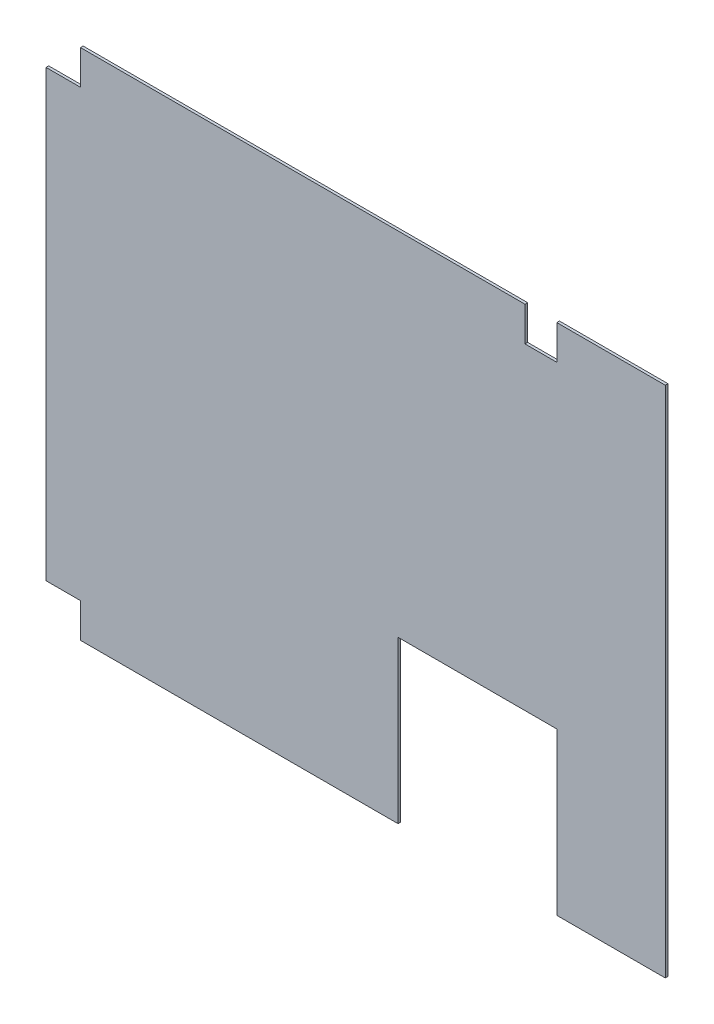
from build123d import *

# Parameters (mm, degrees)
SKETCH1_W           = 742.95
SKETCH1_H           = 615.95
BOSS_EXTRUDE1_DEPTH = 3.175
SKETCH2_W           = 41.275
SKETCH2_H           = 41.275
SKETCH2_W_2         = 38.1
SKETCH2_W_3         = 190.5
SKETCH2_H_2         = 193.675
CUT_EXTRUDE1_DEPTH  = 483.54777678


with BuildPart() as part:
    # Sketch1 → Boss-Extrude1 (new body)
    with BuildSketch(Plane.XY):
        Rectangle(SKETCH1_W, SKETCH1_H)
    extrude(amount=BOSS_EXTRUDE1_DEPTH)

    # Sketch2 → Cut-Extrude1 (cut, through all)
    with BuildSketch(Plane.XY.offset(3.175)):
        with Locations((-350.8375, 287.3375)):
            Rectangle(SKETCH2_W, SKETCH2_H)
        with Locations((-350.8375, -287.3375)):
            Rectangle(SKETCH2_W, SKETCH2_H)
        with Locations((222.25, 287.3375)):
            Rectangle(SKETCH2_W_2, SKETCH2_H)
        with Locations((146.05, -211.1375)):
            Rectangle(SKETCH2_W_3, SKETCH2_H_2)
    extrude(amount=-CUT_EXTRUDE1_DEPTH, mode=Mode.SUBTRACT)


solid = part.part
